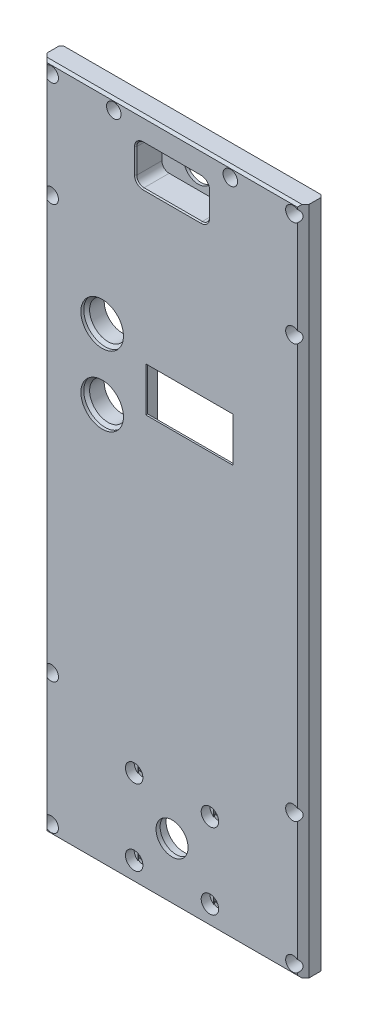
from build123d import *

# Parameters (mm, degrees)
SKETCH1_W                = 90
SKETCH1_H                = 230
SKETCH1_W_2              = 76
SKETCH1_H_2              = 216
BOSS_EXTRUDE1_DEPTH      = 7
SKETCH2_W                = 76
SKETCH2_H                = 36
BOSS_EXTRUDE2_DEPTH      = 7
SKETCH3_R                = 5.5
CUT_EXTRUDE1_DEPTH       = 124.689126442
SKETCH4_R                = 6.05
CUT_EXTRUDE2_DEPTH       = 5.6
SKETCH5_R                = 11.1
CUT_EXTRUDE3_DEPTH       = 3
SKETCH6_R                = 1.7
CUT_EXTRUDE4_DEPTH       = 124.689126442
SKETCH7_W                = 50
SKETCH7_H                = 38
CUT_EXTRUDE5_DEPTH       = 1
SKETCH8_R                = 3
CUT_EXTRUDE6_DEPTH       = 3
SKETCH9_R                = 1.45
CUT_EXTRUDE7_DEPTH       = 124.689126442
SKETCH10_R               = 2.5
CUT_EXTRUDE8_DEPTH       = 5
CHAMFER1_SIZE            = 2
SKETCH11_W               = 76
SKETCH11_H               = 30.5
BOSS_EXTRUDE3_DEPTH      = 7
CUT_EXTRUDE9_DEPTH       = 0.2
SKETCH13_W               = 2.9
SKETCH13_H               = 2.9
CUT_EXTRUDE10_DEPTH      = 0.2
CUT_EXTRUDE11_DEPTH      = 0.2
SKETCH15_W               = 3.4
SKETCH15_H               = 3.4
CUT_EXTRUDE12_DEPTH      = 0.2
CHAMFER3_SIZE            = 0.8
SKETCH16_W               = 2
SKETCH16_H               = 4
BOSS_EXTRUDE4_DEPTH      = 1
BOSS_EXTRUDE4_2_DEPTH    = 1
SKETCH17_R               = 1.45
CUT_EXTRUDE13_DEPTH      = 124.689126442
SKETCH18_R               = 2.5
CUT_EXTRUDE14_DEPTH      = 5
CUT_EXTRUDE15_DEPTH      = 0.2
SKETCH20_W               = 2.9
SKETCH20_H               = 2.9
CUT_EXTRUDE16_DEPTH      = 0.2
SKETCH38_W               = 76
SKETCH38_H               = 56
BOSS_EXTRUDE12_DEPTH     = 7
SKETCH41_W               = 76
SKETCH41_H               = 93.5
BOSS_EXTRUDE13_DEPTH     = 7
SKETCH42_W               = 36.1
SKETCH42_H               = 34.2
CUT_EXTRUDE17_DEPTH      = 6.4
SKETCH43_W               = 30
SKETCH43_H               = 15.2
CUT_EXTRUDE18_DEPTH      = 124.863473228
SKETCH44_R               = 6.3
CUT_EXTRUDE19_DEPTH      = 124.689126442
SKETCH45_W               = 4.85
SKETCH45_H               = 4.85
BOSS_EXTRUDE14_DEPTH     = 1.8
SKETCH46_R               = 1.55
BOSS_EXTRUDE15_DEPTH     = 2
SKETCH49_W               = 25
SKETCH49_H               = 13.5
CUT_EXTRUDE20_DEPTH      = 124.911419974
SKETCH50_W               = 29
SKETCH50_H               = 17.5
SKETCH50_W_2             = 25
SKETCH50_H_2             = 13.5
BOSS_EXTRUDE16_DEPTH     = 2
SKETCH51_W               = 29
SKETCH51_H               = 17.5
BOSS_EXTRUDE17_DEPTH     = 1
CUT_EXTRUDE21_DEPTH      = 124.895116934
CUT_EXTRUDE21_DEPTH_BACK = 124.895116934
SKETCH52_R               = 5
SKETCH53_W               = 8.4
SKETCH53_H               = 5
CUT_EXTRUDE22_DEPTH      = 6
SKETCH54_R               = 7.3
CUT_EXTRUDE23_DEPTH      = 1
CHAMFER4_SIZE            = 1
FILLET1_R                = 2.5
CHAMFER5_SIZE            = 0.4


# Some blends are built 0.0001 mm under size
with BuildPart() as part:
    # Sketch1 → Boss-Extrude1 (new body)
    with BuildSketch(Plane.XY):
        Rectangle(SKETCH1_W, SKETCH1_H)
        Rectangle(SKETCH1_W_2, SKETCH1_H_2, mode=Mode.SUBTRACT)
    extrude(amount=BOSS_EXTRUDE1_DEPTH)

    # Sketch2 → Boss-Extrude2 (add)
    with BuildSketch(Plane.XY.offset(7)):
        with Locations((0, -90)):
            Rectangle(SKETCH2_W, SKETCH2_H)
    extrude(amount=-BOSS_EXTRUDE2_DEPTH)

    # Sketch3 → Cut-Extrude1 (cut, through all)
    with BuildSketch(Plane(origin=(0, 0, 0), x_dir=(-1, 0, 0), z_dir=(0, 0, -1))):
        with Locations((0, -95)):
            Circle(SKETCH3_R)
    extrude(amount=-CUT_EXTRUDE1_DEPTH, mode=Mode.SUBTRACT)

    # Sketch4 → Cut-Extrude2 (cut)
    with BuildSketch(Plane(origin=(0, 0, 0), x_dir=(-1, 0, 0), z_dir=(0, 0, -1))):
        with Locations((0, -95)):
            Circle(SKETCH4_R)
    extrude(amount=-CUT_EXTRUDE2_DEPTH, mode=Mode.SUBTRACT)

    # Sketch5 → Cut-Extrude3 (cut)
    with BuildSketch(Plane(origin=(0, 0, 0), x_dir=(-1, 0, 0), z_dir=(0, 0, -1))):
        with Locations((0, -95)):
            Circle(SKETCH5_R)
    extrude(amount=-CUT_EXTRUDE3_DEPTH, mode=Mode.SUBTRACT)

    # Sketch6 → Cut-Extrude4 (cut, through all)
    with BuildSketch(Plane(origin=(0, 0, 0), x_dir=(-1, 0, 0), z_dir=(0, 0, -1))):
        with Locations((-13, -82)):
            Circle(SKETCH6_R)
        with Locations((13, -82)):
            Circle(SKETCH6_R)
        with Locations((13, -108)):
            Circle(SKETCH6_R)
        with Locations((-13, -108)):
            Circle(SKETCH6_R)
    extrude(amount=-CUT_EXTRUDE4_DEPTH, mode=Mode.SUBTRACT)

    # Sketch7 → Cut-Extrude5 (cut)
    with BuildSketch(Plane(origin=(0, 0, 0), x_dir=(-1, 0, 0), z_dir=(0, 0, -1))):
        with Locations((0, -95)):
            Rectangle(SKETCH7_W, SKETCH7_H)
    extrude(amount=-CUT_EXTRUDE5_DEPTH, mode=Mode.SUBTRACT)

    # Sketch8 → Cut-Extrude6 (cut)
    with BuildSketch(Plane.XY.offset(7)):
        with Locations((-13, -82)):
            Circle(SKETCH8_R)
        with Locations((13, -82)):
            Circle(SKETCH8_R)
        with Locations((13, -108)):
            Circle(SKETCH8_R)
        with Locations((-13, -108)):
            Circle(SKETCH8_R)
    extrude(amount=-CUT_EXTRUDE6_DEPTH, mode=Mode.SUBTRACT)

    # Sketch9 → Cut-Extrude7 (cut, through all)
    with BuildSketch(Plane.XY.offset(7)):
        with Locations((-41.5, 111.5)):
            Circle(SKETCH9_R)
        with Locations((41.5, 111.5)):
            Circle(SKETCH9_R)
        with Locations((41.5, -111.5)):
            Circle(SKETCH9_R)
        with Locations((-41.5, -111.5)):
            Circle(SKETCH9_R)
        with Locations((-41.5, 75.5)):
            Circle(SKETCH9_R)
        with Locations((-41.5, -66.5)):
            Circle(SKETCH9_R)
        with Locations((41.5, -66.5)):
            Circle(SKETCH9_R)
        with Locations((41.5, 75.5)):
            Circle(SKETCH9_R)
    extrude(amount=-CUT_EXTRUDE7_DEPTH, mode=Mode.SUBTRACT)

    # Sketch10 → Cut-Extrude8 (cut)
    with BuildSketch(Plane.XY.offset(7)):
        with Locations((-41.5, 111.5)):
            Circle(SKETCH10_R)
        with Locations((41.5, 111.5)):
            Circle(SKETCH10_R)
        with Locations((-41.5, 75.5)):
            Circle(SKETCH10_R)
        with Locations((-41.5, -66.5)):
            Circle(SKETCH10_R)
        with Locations((-41.5, -111.5)):
            Circle(SKETCH10_R)
        with Locations((41.5, -111.5)):
            Circle(SKETCH10_R)
        with Locations((41.5, 75.5)):
            Circle(SKETCH10_R)
        with Locations((41.5, -66.5)):
            Circle(SKETCH10_R)
    extrude(amount=-CUT_EXTRUDE8_DEPTH, mode=Mode.SUBTRACT)

    # Chamfer1
    # the kernel refuses this chamfer: 2 mm, written as the material it takes off along each edge
    with BuildSketch(Plane(origin=(-45, 120.143365976, 7), x_dir=(-0.027495876610585623, 0, -0.9996219169112968), z_dir=(0, -1, 0)), Plane(origin=(45, -120.143365976, 7), x_dir=(0.027495876610585623, 0, -0.9996219169112968), z_dir=(0, 1, 0))) as chamfer1_piece_1:
        Polygon((CHAMFER1_SIZE * 0.999621916911, CHAMFER1_SIZE * 0.0274958766106), (-CHAMFER1_SIZE * 0.0274958766106, CHAMFER1_SIZE * 0.999621916911), (0, 0), align=None)
    extrude(amount=240.286731952, mode=Mode.SUBTRACT)

    # Sketch11 → Boss-Extrude3 (add)
    with BuildSketch(Plane.XY.offset(7)):
        with Locations((0, -56.75)):
            Rectangle(SKETCH11_W, SKETCH11_H)
    extrude(amount=-BOSS_EXTRUDE3_DEPTH)

    # Sketch12 → Cut-Extrude9 (cut)
    with BuildSketch(Plane.XY.offset(2)):
        with BuildLine():
            Line((-42.95, -113.536541185), (-42.95, -109.463458815))
            ThreePointArc((-42.95, -109.463458815), (-41.5, -109), (-40.05, -109.463458815))
            Line((-40.05, -109.463458815), (-40.05, -113.536541185))
            ThreePointArc((-40.05, -113.536541185), (-41.5, -114), (-42.95, -113.536541185))
        make_face()
        with BuildLine():
            Line((-42.95, -68.536541185), (-42.95, -64.463458815))
            ThreePointArc((-42.95, -64.463458815), (-41.5, -64), (-40.05, -64.463458815))
            Line((-40.05, -64.463458815), (-40.05, -68.536541185))
            ThreePointArc((-40.05, -68.536541185), (-41.5, -69), (-42.95, -68.536541185))
        make_face()
        with BuildLine():
            Line((-42.95, 73.463458815), (-42.95, 77.536541185))
            ThreePointArc((-42.95, 77.536541185), (-41.5, 78), (-40.05, 77.536541185))
            Line((-40.05, 77.536541185), (-40.05, 73.463458815))
            ThreePointArc((-40.05, 73.463458815), (-41.5, 73), (-42.95, 73.463458815))
        make_face()
        with BuildLine():
            Line((-42.95, 109.463458815), (-42.95, 113.536541185))
            ThreePointArc((-42.95, 113.536541185), (-41.5, 114), (-40.05, 113.536541185))
            Line((-40.05, 113.536541185), (-40.05, 109.463458815))
            ThreePointArc((-40.05, 109.463458815), (-41.5, 109), (-42.95, 109.463458815))
        make_face()
    cut_extrude9 = extrude(amount=-CUT_EXTRUDE9_DEPTH, mode=Mode.SUBTRACT)

    # Sketch13 → Cut-Extrude10 (cut)
    with BuildSketch(Plane.XY.offset(1.8)):
        with Locations((-41.5, -111.5)):
            Rectangle(SKETCH13_W, SKETCH13_H)
        with Locations((-41.5, -66.5)):
            Rectangle(SKETCH13_W, SKETCH13_H)
        with Locations((-41.5, 75.5)):
            Rectangle(SKETCH13_W, SKETCH13_H)
        with Locations((-41.5, 111.5)):
            Rectangle(SKETCH13_W, SKETCH13_H)
    cut_extrude10 = extrude(amount=-CUT_EXTRUDE10_DEPTH, mode=Mode.SUBTRACT)

    # Sketch14 → Cut-Extrude11 (cut)
    with BuildSketch(Plane.XY.offset(4)):
        with BuildLine():
            Line((-14.7, -84.471841419), (-14.7, -79.528158581))
            ThreePointArc((-14.7, -79.528158581), (-13, -79), (-11.3, -79.528158581))
            Line((-11.3, -79.528158581), (-11.3, -84.471841419))
            ThreePointArc((-11.3, -84.471841419), (-13, -85), (-14.7, -84.471841419))
        make_face()
        with BuildLine():
            Line((-14.7, -110.471841419), (-14.7, -105.528158581))
            ThreePointArc((-14.7, -105.528158581), (-13, -105), (-11.3, -105.528158581))
            Line((-11.3, -105.528158581), (-11.3, -110.471841419))
            ThreePointArc((-11.3, -110.471841419), (-13, -111), (-14.7, -110.471841419))
        make_face()
    cut_extrude11 = extrude(amount=-CUT_EXTRUDE11_DEPTH, mode=Mode.SUBTRACT)

    # Sketch15 → Cut-Extrude12 (cut)
    with BuildSketch(Plane.XY.offset(3.8)):
        with Locations((-13, -82)):
            Rectangle(SKETCH15_W, SKETCH15_H)
        with Locations((-13, -108)):
            Rectangle(SKETCH15_W, SKETCH15_H)
    cut_extrude12 = extrude(amount=-CUT_EXTRUDE12_DEPTH, mode=Mode.SUBTRACT)

    # Mirror1: Cut-Extrude9, Cut-Extrude10, Cut-Extrude11, Cut-Extrude12 across plane
    add(cut_extrude9.mirror(Plane(origin=(0, 0, 0), x_dir=(0, 0, 1), z_dir=(1, 0, 0))), mode=Mode.SUBTRACT)
    add(cut_extrude10.mirror(Plane(origin=(0, 0, 0), x_dir=(0, 0, 1), z_dir=(1, 0, 0))), mode=Mode.SUBTRACT)
    add(cut_extrude11.mirror(Plane(origin=(0, 0, 0), x_dir=(0, 0, 1), z_dir=(1, 0, 0))), mode=Mode.SUBTRACT)
    add(cut_extrude12.mirror(Plane(origin=(0, 0, 0), x_dir=(0, 0, 1), z_dir=(1, 0, 0))), mode=Mode.SUBTRACT)

    # Chamfer3
    chamfer3_edges = [part.edges().sort_by_distance(p)[0] for p in [
        (0, 115, 7),
        (0, -115, 7),
        (-45, 0, 0),
        (45, 0, 0),
    ]]
    chamfer(chamfer3_edges, length=CHAMFER3_SIZE)

    # Sketch17 → Cut-Extrude13 (cut, through all)
    with BuildSketch(Plane(origin=(0, 0, 0), x_dir=(-1, 0, 0), z_dir=(0, 0, -1))):
        with Locations((-20, 111.5)):
            Circle(SKETCH17_R)
        with Locations((20, 111.5)):
            Circle(SKETCH17_R)
    extrude(amount=-CUT_EXTRUDE13_DEPTH, mode=Mode.SUBTRACT)

    # Sketch18 → Cut-Extrude14 (cut)
    with BuildSketch(Plane.XY.offset(7)):
        with Locations((-20, 111.5)):
            Circle(SKETCH18_R)
        with Locations((20, 111.5)):
            Circle(SKETCH18_R)
    extrude(amount=-CUT_EXTRUDE14_DEPTH, mode=Mode.SUBTRACT)

    # Sketch19 → Cut-Extrude15 (cut)
    with BuildSketch(Plane.XY.offset(2)):
        with BuildLine():
            Line((-21.45, 109.463458815), (-21.45, 113.536541185))
            ThreePointArc((-21.45, 113.536541185), (-20, 114), (-18.55, 113.536541185))
            Line((-18.55, 113.536541185), (-18.55, 109.463458815))
            ThreePointArc((-18.55, 109.463458815), (-20, 109), (-21.45, 109.463458815))
        make_face()
        with BuildLine():
            Line((18.55, 109.463458815), (18.55, 113.536541185))
            ThreePointArc((18.55, 113.536541185), (20, 114), (21.45, 113.536541185))
            Line((21.45, 113.536541185), (21.45, 109.463458815))
            ThreePointArc((21.45, 109.463458815), (20, 109), (18.55, 109.463458815))
        make_face()
    extrude(amount=-CUT_EXTRUDE15_DEPTH, mode=Mode.SUBTRACT)

    # Sketch20 → Cut-Extrude16 (cut)
    with BuildSketch(Plane.XY.offset(1.8)):
        with Locations((-20, 111.5)):
            Rectangle(SKETCH20_W, SKETCH20_H)
        with Locations((20, 111.5)):
            Rectangle(SKETCH20_W, SKETCH20_H)
    extrude(amount=-CUT_EXTRUDE16_DEPTH, mode=Mode.SUBTRACT)

    # Sketch38 → Boss-Extrude12 (add)
    with BuildSketch(Plane.XY.offset(7)):
        with Locations((0, 80)):
            Rectangle(SKETCH38_W, SKETCH38_H)
    extrude(amount=-BOSS_EXTRUDE12_DEPTH)

    # Sketch41 → Boss-Extrude13 (add)
    with BuildSketch(Plane.XY.offset(7)):
        with Locations((0, 5.25)):
            Rectangle(SKETCH41_W, SKETCH41_H)
    extrude(amount=-BOSS_EXTRUDE13_DEPTH)

    # Sketch42 → Cut-Extrude17 (cut)
    with BuildSketch(Plane(origin=(0, 0, 0), x_dir=(-1, 0, 0), z_dir=(0, 0, -1))):
        with Locations((-6, 32.1)):
            Rectangle(SKETCH42_W, SKETCH42_H)
    extrude(amount=-CUT_EXTRUDE17_DEPTH, mode=Mode.SUBTRACT)

    # Sketch43 → Cut-Extrude18 (cut, through all)
    with BuildSketch(Plane(origin=(0, 0, 6.4), x_dir=(-1, 0, 0), z_dir=(0, 0, -1))):
        with Locations((-6, 34)):
            Rectangle(SKETCH43_W, SKETCH43_H)
    extrude(amount=-CUT_EXTRUDE18_DEPTH, mode=Mode.SUBTRACT)

    # Sketch44 → Cut-Extrude19 (cut, through all)
    with BuildSketch(Plane(origin=(0, 0, 0), x_dir=(-1, 0, 0), z_dir=(0, 0, -1))):
        with Locations((24, 22)):
            Circle(SKETCH44_R)
        with Locations((24, 46)):
            Circle(SKETCH44_R)
    extrude(amount=-CUT_EXTRUDE19_DEPTH, mode=Mode.SUBTRACT)

    # Sketch45 → Boss-Extrude14 (add)
    with BuildSketch(Plane(origin=(0, 0, 6.4), x_dir=(-1, 0, 0), z_dir=(0, 0, -1))):
        with Locations((-21.625, 46.775)):
            Rectangle(SKETCH45_W, SKETCH45_H)
        with Locations((9.625, 46.775)):
            Rectangle(SKETCH45_W, SKETCH45_H)
        with Locations((9.625, 17.425)):
            Rectangle(SKETCH45_W, SKETCH45_H)
        with Locations((-21.625, 17.425)):
            Rectangle(SKETCH45_W, SKETCH45_H)
    extrude(amount=BOSS_EXTRUDE14_DEPTH)

    # Sketch46 → Boss-Extrude15 (add)
    with BuildSketch(Plane(origin=(0, 0, 4.6), x_dir=(-1, 0, 0), z_dir=(0, 0, -1))):
        with Locations((9.2, 17.85)):
            Circle(SKETCH46_R)
        with Locations(Location((-21.2, 17.85, 0), (0, 0, 180))):
            Circle(SKETCH46_R)
        with Locations((-21.2, 46.35)):
            Circle(SKETCH46_R)
        with Locations(Location((9.2, 46.35, 0), (0, 0, 180))):
            Circle(SKETCH46_R)
    extrude(amount=BOSS_EXTRUDE15_DEPTH)

    # Sketch49 → Cut-Extrude20 (cut, through all)
    with BuildSketch(Plane.XY.offset(7)):
        with Locations((0, 100)):
            Rectangle(SKETCH49_W, SKETCH49_H)
    extrude(amount=-CUT_EXTRUDE20_DEPTH, mode=Mode.SUBTRACT)

    # Sketch50 → Boss-Extrude16 (add)
    with BuildSketch(Plane(origin=(0, 0, 0), x_dir=(-1, 0, 0), z_dir=(0, 0, -1))):
        with Locations((0, 100)):
            Rectangle(SKETCH50_W, SKETCH50_H)
        with Locations((0, 100)):
            Rectangle(SKETCH50_W_2, SKETCH50_H_2, mode=Mode.SUBTRACT)
    extrude(amount=BOSS_EXTRUDE16_DEPTH)

    # Sketch51 → Boss-Extrude17 (add)
    with BuildSketch(Plane(origin=(0, 0, -2), x_dir=(-1, 0, 0), z_dir=(0, 0, -1))):
        with Locations((0, 100)):
            Rectangle(SKETCH51_W, SKETCH51_H)
    extrude(amount=BOSS_EXTRUDE17_DEPTH)

    # Sketch52 → Cut-Extrude21 (cut, two sides: drawn at the far end of the back side and taken through both)
    with BuildSketch(Plane(origin=(0, 0, -3), x_dir=(-1, 0, 0), z_dir=(0, 0, -1)).offset(-CUT_EXTRUDE21_DEPTH_BACK)):
        with Locations((0, 100)):
            Circle(SKETCH52_R)
    extrude(amount=CUT_EXTRUDE21_DEPTH + CUT_EXTRUDE21_DEPTH_BACK, mode=Mode.SUBTRACT)

    # Sketch53 → Cut-Extrude22 (cut)
    with BuildSketch(Plane.ZY.offset(-12.5)):
        with Locations((2.2, 100)):
            Rectangle(SKETCH53_W, SKETCH53_H)
    extrude(amount=-CUT_EXTRUDE22_DEPTH, mode=Mode.SUBTRACT)

    # Sketch54 → Cut-Extrude23 (cut)
    with BuildSketch(Plane.XY.offset(7)):
        with Locations((-24, 46)):
            Circle(SKETCH54_R)
        with Locations((-24, 22)):
            Circle(SKETCH54_R)
    extrude(amount=-CUT_EXTRUDE23_DEPTH, mode=Mode.SUBTRACT)

    # Chamfer4
    chamfer4_edges = [part.edges().sort_by_distance(p)[0] for p in [
        (-17.7, 46, 6),
        (-17.7, 22, 6),
    ]]
    chamfer(chamfer4_edges, length=CHAMFER4_SIZE - 0.0001)  # a hair under: the kernel refuses the full size

    # Fillet1
    fillet1_edges = [part.edges().sort_by_distance(p)[0] for p in [
        (12.5, 106.75, 3.5),
        (12.5, 93.25, 3.5),
        (-12.5, 93.25, 3.5),
        (-12.5, 106.75, 3.5),
    ]]
    fillet(fillet1_edges, radius=FILLET1_R)

    # Chamfer5
    chamfer5_edges = [part.edges().sort_by_distance(p)[0] for p in [
        (12.5, 100, 7),
        (0, 93.25, 7),
        (-12.5, 100, 7),
        (0, 106.75, 7),
        (11.767766953, 93.982233047, 7),
        (-11.767766953, 93.982233047, 7),
        (11.767766953, 106.017766953, 7),
        (-11.767766953, 106.017766953, 7),
    ]]
    chamfer(chamfer5_edges, length=CHAMFER5_SIZE)


with BuildPart() as body_2:
    # Sketch16 → Boss-Extrude4 (new, symmetric)
    with BuildSketch(Plane(origin=(0, 0, 0), x_dir=(0, 0, -1), z_dir=(1, 0, 0))):
        Polygon((0, -4), (0, -15.4), (3.2, -12.2), (3.2, -7.2), align=None)
        with Locations((1.6, -9.7)):
            Rectangle(SKETCH16_W, SKETCH16_H, mode=Mode.SUBTRACT)
    extrude(amount=BOSS_EXTRUDE4_DEPTH, both=True)


with BuildPart() as body_3:
    # Sketch16 → Boss-Extrude4 2 (new, symmetric)
    with BuildSketch(Plane(origin=(0, 0, 0), x_dir=(0, 0, -1), z_dir=(1, 0, 0))):
        Polygon((3.2, -27.6), (0, -30.8), (0, -19.4), (3.2, -22.6), align=None)
        with Locations((1.6, -25.1)):
            Rectangle(SKETCH16_W, SKETCH16_H, mode=Mode.SUBTRACT)
    extrude(amount=BOSS_EXTRUDE4_2_DEPTH, both=True)


solid = Compound([part.part, body_2.part, body_3.part])
